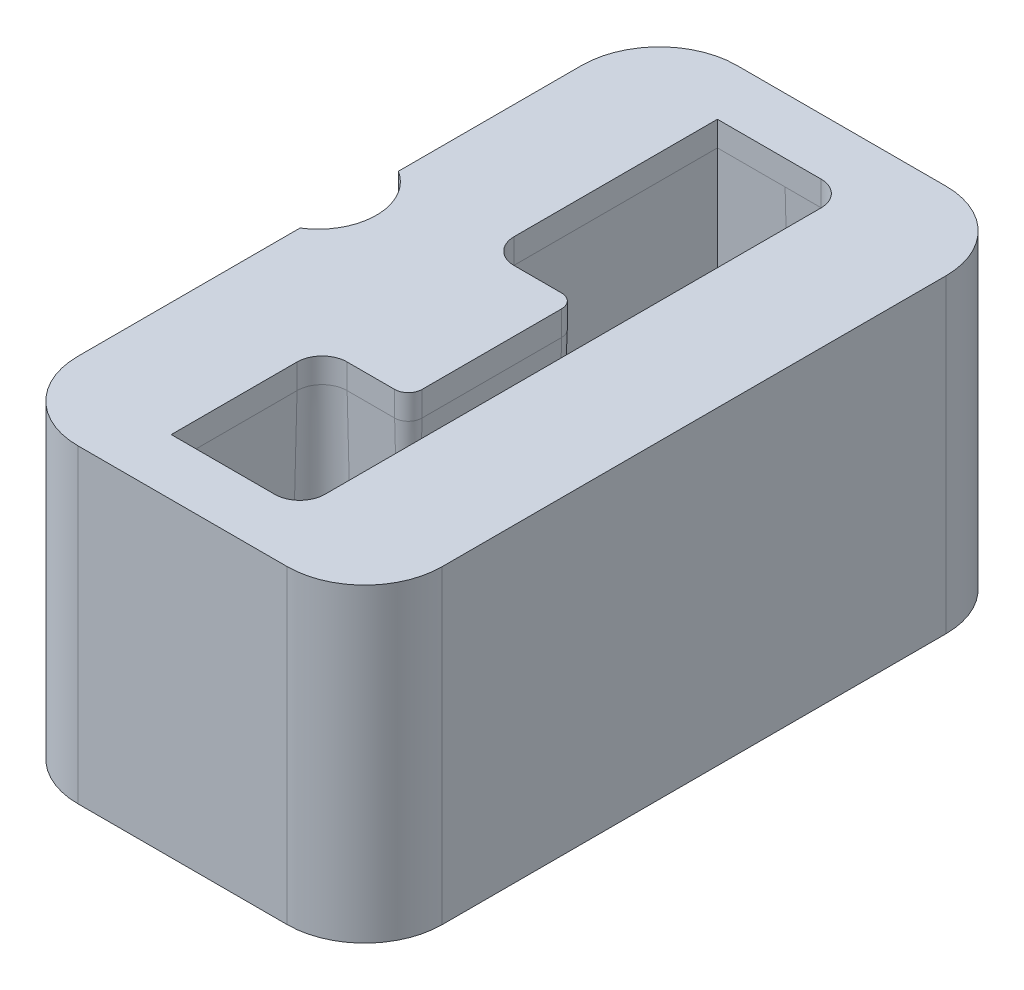
from build123d import *

# Parameters (mm, degrees)
SKETCH1_W                   = 47
SKETCH1_H                   = 85
BOSS_EXTRUDE1_DEPTH         = 40
FILLET1_R                   = 10
CUT_EXTRUDE1_REACH          = 64.917
M6_TAPPED_HOLE1_D           = 5
M6_TAPPED_HOLE1_DEPTH       = 17
M6_TAPPED_HOLE1_CSINK_D     = 6.05
M6_TAPPED_HOLE1_CSINK_ANGLE = 90
M6_TAPPED_HOLE1_TIP         = 1.502151548
SKETCH9_R                   = 7.5
CUT_EXTRUDE2_DEPTH          = 268.695101375
SKETCH10_R                  = 10
CUT_EXTRUDE3_DEPTH          = 30


with BuildPart() as part:
    # Sketch1 → Boss-Extrude1 (new body)
    with BuildSketch(Plane(origin=(0, 0, 0), x_dir=(1, 0, 0), z_dir=(0, 1, 0))):
        Rectangle(SKETCH1_W, SKETCH1_H)
    extrude(amount=-BOSS_EXTRUDE1_DEPTH)

    # Fillet1
    fillet1_edges = [part.edges().sort_by_distance(p)[0] for p in [
        (-23.5, -20, -42.5),
        (23.5, -20, -42.5),
        (-23.5, -20, 42.5),
        (23.5, -20, 42.5),
    ]]
    fillet(fillet1_edges, radius=FILLET1_R)

    # Sketch3 → Cut-Extrude1 (cut, up to next)
    with BuildSketch(Plane(origin=(0, 0, 0), x_dir=(1, 0, 0), z_dir=(0, 1, 0)), mode=Mode.PRIVATE) as cut_extrude1_sk1:
        with BuildLine():
            Line((4.63, 35.23), (-8.73, 35.23))
            Line((-8.73, 35.23), (-8.73, 9))
            ThreePointArc((-8.73, 9), (-7.783954903, 6.716045097), (-5.5, 5.77))
            Line((-5.5, 5.77), (0.63, 5.77))
            ThreePointArc((0.63, 5.77), (1.881579003, 5.251579003), (2.4, 4))
            Line((2.4, 4), (2.4, -14))
            ThreePointArc((2.4, -14), (1.881579003, -15.251579003), (0.63, -15.77))
            Line((0.63, -15.77), (-5.5, -15.77))
            ThreePointArc((-5.5, -15.77), (-7.783954903, -16.716045097), (-8.73, -19))
            Line((-8.73, -19), (-8.73, -35.23))
            Line((-8.73, -35.23), (4.63, -35.23))
            ThreePointArc((4.63, -35.23), (6.913954903, -34.283954903), (7.86, -32))
            Line((7.86, -32), (7.86, 32))
            ThreePointArc((7.86, 32), (6.913954903, 34.283954903), (4.63, 35.23))
        make_face()
    cut_extrude1_tool1 = extrude(cut_extrude1_sk1.sketch, amount=-CUT_EXTRUDE1_REACH, mode=Mode.PRIVATE) & part.part
    add(cut_extrude1_tool1.solids().sort_by_distance((7.136133, 0, 0))[0], mode=Mode.SUBTRACT)

    # Cut-Sweep1: sweep along a path in Sketch5
    with BuildLine(Plane(origin=(0, 0, 0), x_dir=(1, 0, 0), z_dir=(0, 1, 0))) as cut_sweep1_path:
        Line((-8.73, -35.23), (4.63, -35.23))
        ThreePointArc((4.63, -35.23), (6.913954903, -34.283954903), (7.86, -32))
        Line((7.86, -32), (7.86, 32))
        ThreePointArc((7.86, 32), (6.913954903, 34.283954903), (4.63, 35.23))
        Line((4.63, 35.23), (-8.73, 35.23))
        Line((-8.73, 35.23), (-8.73, 9))
        ThreePointArc((-8.73, 9), (-7.783954903, 6.716045097), (-5.5, 5.77))
        Line((-5.5, 5.77), (0.63, 5.77))
        ThreePointArc((0.63, 5.77), (1.881579003, 5.251579003), (2.4, 4))
        Line((2.4, 4), (2.4, -14))
        ThreePointArc((2.4, -14), (1.881579003, -15.251579003), (0.63, -15.77))
        Line((0.63, -15.77), (-5.5, -15.77))
        ThreePointArc((-5.5, -15.77), (-7.783954903, -16.716045097), (-8.73, -19))
        Line((-8.73, -19), (-8.73, -35.23))
    # Sketch4 → Cut-Sweep1 (sweep, cut)
    with BuildSketch(Plane(origin=(0, 0, 0), x_dir=(0, 0, -1), z_dir=(1, 0, 0))):
        Polygon((35.23, -3.2), (36.193641914, -40), (35.23, -40), align=None)
    sweep(path=cut_sweep1_path.line, transition=Transition.RIGHT, mode=Mode.SUBTRACT)

    # M6 Tapped Hole1
    with Locations(Plane(origin=(0, -40, 0), x_dir=(-1, 0, 0), z_dir=(0, -1, 0))):
        with Locations((-16.5, 35.5), (16.5, 35.5), (16.5, -35.5), (-16.5, -35.5)):
            CounterSinkHole(M6_TAPPED_HOLE1_D / 2, M6_TAPPED_HOLE1_CSINK_D / 2, depth=M6_TAPPED_HOLE1_DEPTH, counter_sink_angle=M6_TAPPED_HOLE1_CSINK_ANGLE)
            with Locations((0, 0, -(M6_TAPPED_HOLE1_DEPTH + M6_TAPPED_HOLE1_TIP / 2))):  # 118° drill point
                Cone(0, M6_TAPPED_HOLE1_D / 2, M6_TAPPED_HOLE1_TIP, mode=Mode.SUBTRACT)

    # Sketch9 → Cut-Extrude2 (cut, through all)
    with BuildSketch(Plane(origin=(236.38, 0, 7.73), x_dir=(1, 0, 0), z_dir=(0, 1, 0))):
        with Locations((-263.88, 10.23)):
            Circle(SKETCH9_R)
    extrude(amount=-CUT_EXTRUDE2_DEPTH, mode=Mode.SUBTRACT)

    # Sketch10 → Cut-Extrude3 (cut)
    with BuildSketch(Plane(origin=(236.38, -40, 7.73), x_dir=(1, 0, 0), z_dir=(0, -1, 0))):
        with Locations((-263.88, -10.23)):
            Circle(SKETCH10_R)
    extrude(amount=-CUT_EXTRUDE3_DEPTH, mode=Mode.SUBTRACT)


solid = part.part
